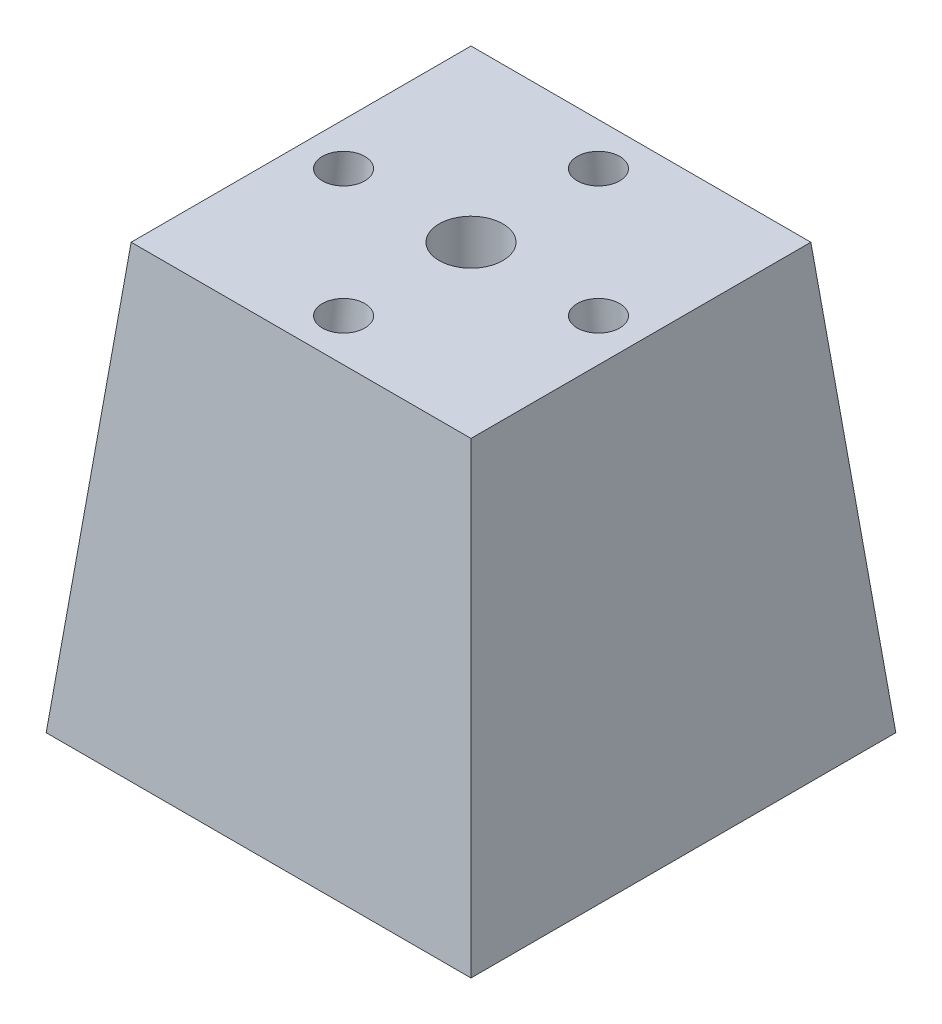
from build123d import *

# Parameters (mm, degrees)
LOFT1_OUTLINE_W    = 80
LOFT1_OUTLINE_H    = 80
LOFT1_DEPTH        = 100
LOFT1_DRAFT        = 5.7105931
SKETCH4_R          = 7.5
CUT_EXTRUDE1_DEPTH = 123.474487085
SKETCH7_R          = 5
SKETCH9_R          = 5


# Read off the part's stored shape, not the designer's step: Loft1
with BuildPart() as part:
    # Loft1 outline → Loft1 (with draft: the straight prism first)
    with BuildSketch(Plane(origin=(0, 100, 0), x_dir=(1, 0, 0), z_dir=(0, 1, 0))):
        Rectangle(LOFT1_OUTLINE_W, LOFT1_OUTLINE_H)
    extrude(amount=-LOFT1_DEPTH)
    # Loft1: the draft: its side faces are tilted about the plane it starts from
    loft1_sides = [part.faces().sort_by_distance(p)[0] for p in [
        (40, 50, 0),
        (0, 50, -40),
        (-40, 50, 0),
        (0, 50, 40),
    ]]
    draft(loft1_sides, Plane(origin=(0, 100, 0), x_dir=(1, 0, 0), z_dir=(0, 1, 0)), LOFT1_DRAFT)

    # Sketch4 → Cut-Extrude1 (cut, through all)
    with BuildSketch(Plane(origin=(0, 100, 0), x_dir=(1, 0, 0), z_dir=(0, 1, 0))):
        with Locations(Location((0, 0, 0), (0, 0, 270))):
            Circle(SKETCH4_R)
    extrude(amount=-CUT_EXTRUDE1_DEPTH, mode=Mode.SUBTRACT)

    # Cut-Sweep1: sweep along a path in Sketch8
    with BuildLine(Plane.XY) as cut_sweep1_path:
        Line((-30, 100), (-40, 0))
    # Sketch7 → Cut-Sweep1 (sweep, cut)
    with BuildSketch(Plane(origin=(0, 100, 0), x_dir=(1, 0, 0), z_dir=(0, 1, 0))):
        with Locations((-30, 0)):
            Circle(SKETCH7_R)
    cut_sweep1 = sweep(path=cut_sweep1_path.line, mode=Mode.SUBTRACT)

    # Mirror1: Cut-Sweep1 across plane
    add(cut_sweep1.mirror(Plane(origin=(0, 0, 0), x_dir=(0, 0, 1), z_dir=(1, 0, 0))), mode=Mode.SUBTRACT)

    # Cut-Sweep2: sweep along a path in Sketch10
    with BuildLine(Plane(origin=(0, 0, 0), x_dir=(0, 0, -1), z_dir=(1, 0, 0))) as cut_sweep2_path:
        Line((-30, 100), (-40, 0))
    # Sketch9 → Cut-Sweep2 (sweep, cut)
    with BuildSketch(Plane(origin=(0, 100, 0), x_dir=(1, 0, 0), z_dir=(0, 1, 0))):
        with Locations((0, -30)):
            Circle(SKETCH9_R)
    cut_sweep2 = sweep(path=cut_sweep2_path.line, mode=Mode.SUBTRACT)

    # Mirror2: Cut-Sweep2 across plane
    add(cut_sweep2.mirror(Plane.XY), mode=Mode.SUBTRACT)


solid = part.part
